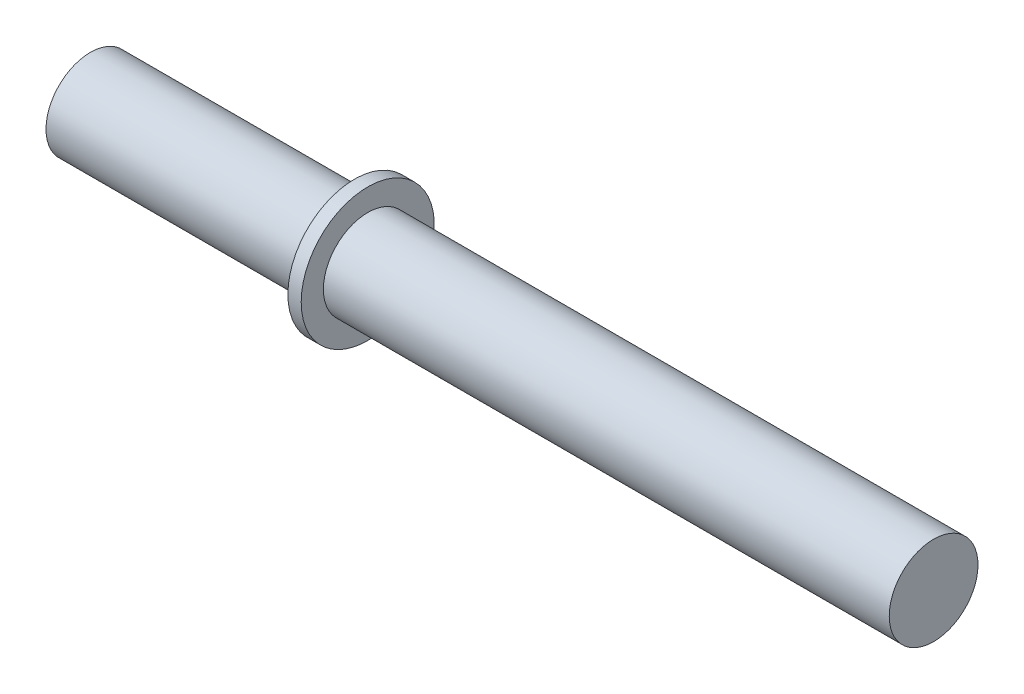
from build123d import *

# Parameters (mm, degrees)
SALIENTE_EXTRUIR1_START = 8
CROQUIS1_R              = 10
SALIENTE_EXTRUIR1_DEPTH = 190
CROQUIS2_R              = 15
SALIENTE_EXTRUIR2_DEPTH = 3


with BuildPart() as part:
    # Croquis1 → Saliente-Extruir1 (new body)
    with BuildSketch(Plane(origin=(0, 0, 0), x_dir=(0, 0, -1), z_dir=(1, 0, 0)).offset(SALIENTE_EXTRUIR1_START)):
        Circle(CROQUIS1_R)
    extrude(amount=SALIENTE_EXTRUIR1_DEPTH)

    # Croquis2 → Saliente-Extruir2 (add)
    with BuildSketch(Plane.ZY.offset(-70.5)):
        Circle(CROQUIS2_R)
    extrude(amount=SALIENTE_EXTRUIR2_DEPTH)


solid = part.part
